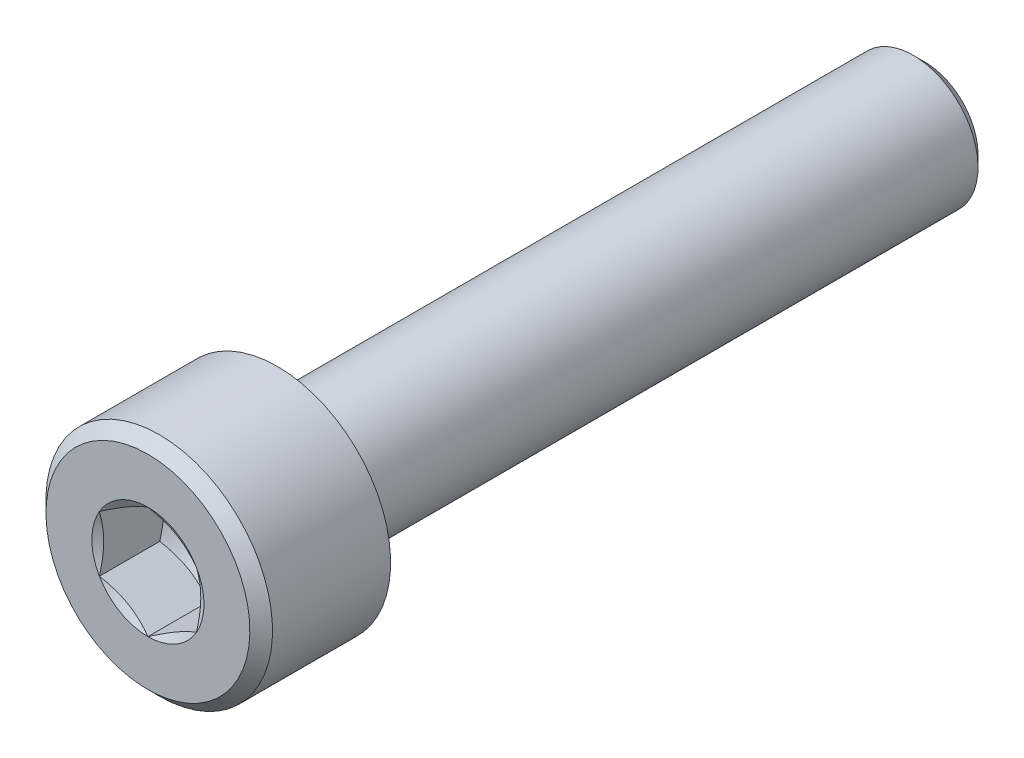
from build123d import *

# Parameters (mm, degrees)
CHAMFER1_SIZE      = 0.35
CUT_EXTRUDE1_REACH = 26.505
FILLET2_R          = 0.4


with BuildPart() as part:
    # Sketch1 → Revolve1 (revolve)
    with BuildSketch(Plane(origin=(0, 0, 0), x_dir=(0, 0, -1), z_dir=(1, 0, 0))):
        Polygon((0, 3.5), (-4, 3.5), (-4, 0), (20, 0), (20, 2), (0, 2), align=None)
    revolve(axis=Axis((0, 0, 4), (0, 0, -1)))

    # Sketch7 → Cut-Revolve2 (revolve, cut)
    with BuildSketch(Plane(origin=(0, 0, 0), x_dir=(0, 0, -1), z_dir=(1, 0, 0))):
        Polygon((-4, 0), (-4, 1.5), (-2, 1.5), (-1.133974596, 0), align=None)
    revolve(axis=Axis((0, 0, 4), (0, 0, -1)), mode=Mode.SUBTRACT)

    # Chamfer1
    chamfer1_edges = [part.edges().sort_by_distance(p)[0] for p in [
        (0, -2, -20),
        (0, -3.5, 4),
    ]]
    chamfer(chamfer1_edges, length=CHAMFER1_SIZE)

    # Cut-Extrude1: up to this cone (the profile starts inside it)
    cut_extrude1_end = Plane(origin=(0, 0, 4), z_dir=(0, 0, 1)).offset(-2.866024404) * Cone(1.732e-06, 60.336209885, 34.835126019, align=(Align.CENTER, Align.CENTER, Align.MIN), mode=Mode.PRIVATE)
    # Sketch8 → Cut-Extrude1 (cut, up to the surface)
    with BuildSketch(Plane.XY.offset(4), mode=Mode.PRIVATE) as cut_extrude1_sk1:
        Polygon((0, 1.732050808), (-1.5, 0.866025404), (-1.5, -0.866025404), (0, -1.732050808), (1.5, -0.866025404), (1.5, 0.866025404), align=None)
    cut_extrude1_tool1 = extrude(cut_extrude1_sk1.sketch, amount=-CUT_EXTRUDE1_REACH, mode=Mode.PRIVATE) & cut_extrude1_end
    add(cut_extrude1_tool1.solids().sort_by_distance((0, 0, 4))[0], mode=Mode.SUBTRACT)

    # Sketch9 → Cut-Revolve3 (revolve, cut)
    with BuildSketch(Plane(origin=(0, 0, 0), x_dir=(0, 0, -1), z_dir=(1, 0, 0))):
        Polygon((-4.5, 2.598076211), (-4.5, 1.5), (-3.866025404, 1.5), align=None)
    revolve(axis=Axis((0, 0, 4), (0, 0, -1)), mode=Mode.SUBTRACT)

    # Fillet2
    fillet2_edges = [part.edges().sort_by_distance(p)[0] for p in [
        (0, -2, 0),
    ]]
    fillet(fillet2_edges, radius=FILLET2_R)


solid = part.part
